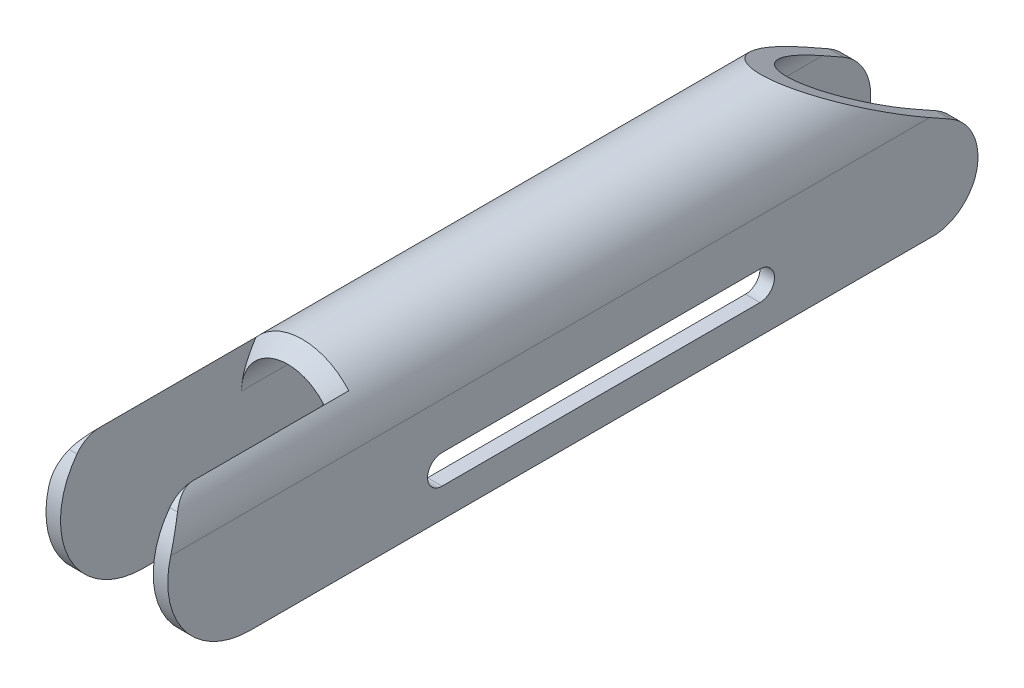
from build123d import *

# Parameters (mm, degrees)
WHOLEBODY_DEPTH    = 280
UPPERCURVE_DEPTH   = 286.41198293
SKETCH6_W          = 32
SKETCH6_H          = 5
CUT_EXTRUDE5_DEPTH = 285.921480537
CUT_EXTRUDE6_DEPTH = 286.411983055
UPPERHOLE_DEPTH    = 289.81308838
CHAMFER1_SIZE      = 10
CUT_EXTRUDE8_DEPTH = 286.411982957
CUT_EXTRUDE9_DEPTH = 286.411982957


with BuildPart() as part:
    # Sketch1 → WholeBody (new body)
    with BuildSketch(Plane.XY):
        with BuildLine():
            Line((0, 0), (0, -36))
            Line((0, -36), (42, -36))
            Line((42, -36), (42, 0))
            ThreePointArc((42, 0), (21, 21), (0, 0))
        make_face()
    extrude(amount=-WHOLEBODY_DEPTH)

    # Sketch2 → UpperCurve (cut, through all)
    with BuildSketch(Plane(origin=(42, 0, 0), x_dir=(0, 0, -1), z_dir=(1, 0, 0))):
        with BuildLine():
            ThreePointArc((29, -36), (0.5, -7.5), (29, 21))
            Line((29, 21), (0, 21))
            Line((0, 21), (0, 0))
            Line((0, 0), (0, -36))
            Line((0, -36), (29, -36))
        make_face()
    extrude(amount=-UPPERCURVE_DEPTH, mode=Mode.SUBTRACT)

    # Sketch6 → Cut-Extrude5 (cut, through all)
    with BuildSketch(Plane(origin=(0, 0, -280), x_dir=(-1, 0, 0), z_dir=(0, 0, -1))):
        with BuildLine():
            Line((-37, 0), (-37, -31))
            Line((-37, -31), (-5, -31))
            Line((-5, -31), (-5, 0))
            ThreePointArc((-5, 0), (-21, 16), (-37, 0))
        make_face()
        with Locations((-21, -33.5)):
            Rectangle(SKETCH6_W, SKETCH6_H)
    extrude(amount=-CUT_EXTRUDE5_DEPTH, mode=Mode.SUBTRACT)

    # Sketch8 → Cut-Extrude6 (cut, through all)
    with BuildSketch(Plane.ZY):
        Polygon((-263.367084443, 0), (-226.082527774, 21), (-280, 21), (-280, 0), align=None)
        with BuildLine():
            Line((-270.565078665, -4.054168593), (-263.367084443, 0))
            Line((-263.367084443, 0), (-280, 0))
            Line((-280, 0), (-280, -20.196793601))
            ThreePointArc((-280, -20.196793601), (-277.468291323, -10.847969039), (-270.565078665, -4.054168593))
        make_face()
        with BuildLine():
            ThreePointArc((-265.552960254, -36), (-275.843932749, -30.902613162), (-280, -20.196793601))
            Line((-280, -20.196793601), (-280, -36))
            Line((-280, -36), (-265.552960254, -36))
        make_face()
    extrude(amount=-CUT_EXTRUDE6_DEPTH, mode=Mode.SUBTRACT)

    # Sketch9 → UpperHole (cut, through all)
    with BuildSketch(Plane.XZ.offset(36)):
        Polygon((5, -0.5), (5, -57.942137899), (37, -57.942137899), (37, -29), (37, 4.098042087), (5, 4.098042087), align=None)
    extrude(amount=-UPPERHOLE_DEPTH, mode=Mode.SUBTRACT)

    # Chamfer1
    # the kernel refuses this chamfer: 10 mm, written as the material it takes off along each edge
    with BuildSketch(Plane(origin=(21, 0, -57.942137899), x_dir=(0.86749005683434, -0.49745452183446237, 0), z_dir=(-0.49745452183446237, -0.86749005683434, 0))) as chamfer1_piece_1_section:
        Polygon((21, -CHAMFER1_SIZE), (21 - CHAMFER1_SIZE, 0), (21, 0), align=None)
    chamfer1_piece_1 = revolve(axis=Axis((21, 0, -57.942137899), (0, 0, 1)), revolution_arc=239.663469858, mode=Mode.PRIVATE)
    chamfer1_piece_1 = split(chamfer1_piece_1, bisect_by=Plane(origin=(5, 16.096053983, -62.846083916), z_dir=(1, 0, 0)), keep=Keep.TOP, mode=Mode.PRIVATE)
    chamfer1_piece_1 = split(chamfer1_piece_1, bisect_by=Plane(origin=(37, 16.096053983, -62.846083916), z_dir=(-1, 0, 0)), keep=Keep.TOP, mode=Mode.PRIVATE)
    add(chamfer1_piece_1, mode=Mode.SUBTRACT)

    # Sketch11 → Cut-Extrude8 (cut, through all)
    with BuildSketch(Plane.ZY):
        with BuildLine():
            Line((-9.843331647, 13.601470509), (-14.201102996, 13.601470509))
            ThreePointArc((-14.201102996, 13.601470509), (-9.729411408, 12.545964589), (-6.20169921, 9.602265378))
            ThreePointArc((-6.20169921, 9.602265378), (-7.927428506, 11.688453055), (-9.843331647, 13.601470509))
        make_face()
    extrude(amount=-CUT_EXTRUDE8_DEPTH, mode=Mode.SUBTRACT)

    # Sketch12 → Cut-Extrude9 (cut, through all)
    with BuildSketch(Plane.ZY):
        with BuildLine():
            Line((-204.781024531, -15.957949817), (-95.140934308, -15.957949817))
            ThreePointArc((-95.140934308, -15.957949817), (-90.128815898, -20.970068227), (-95.140934308, -25.982186638))
            Line((-95.140934308, -25.982186638), (-204.781024531, -25.982186638))
            ThreePointArc((-204.781024531, -25.982186638), (-209.793142941, -20.970068227), (-204.781024531, -15.957949817))
        make_face()
    extrude(amount=-CUT_EXTRUDE9_DEPTH, mode=Mode.SUBTRACT)


solid = part.part
